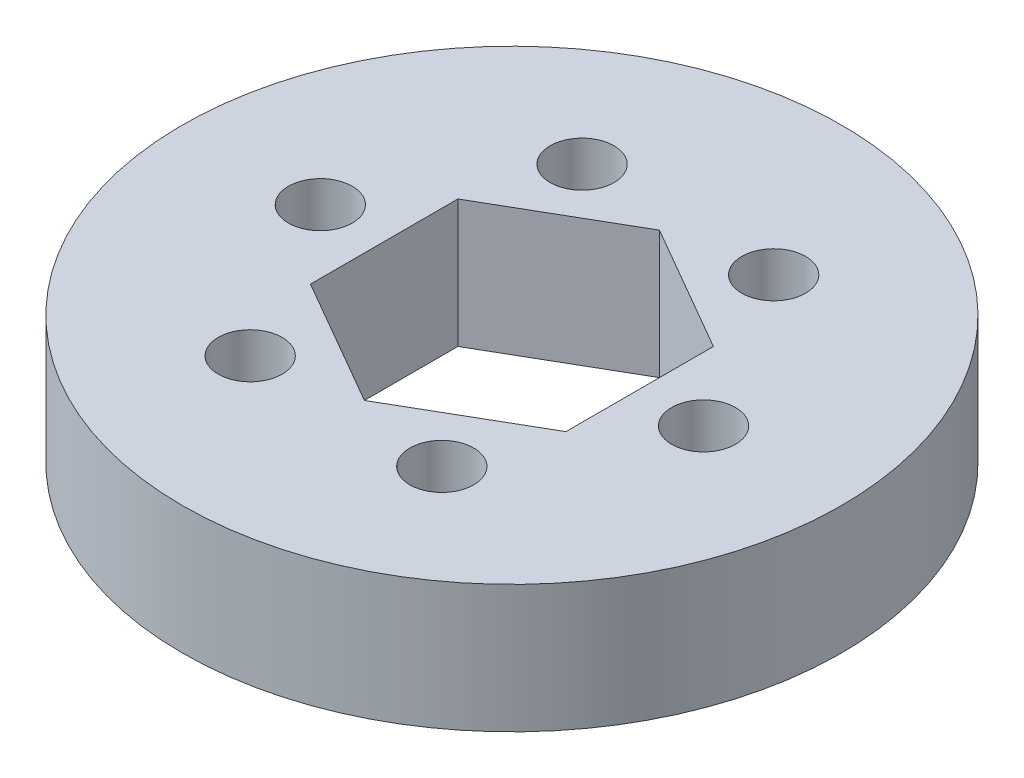
from build123d import *

# Parameters (mm, degrees)
SKETCH1_R           = 16.383
BOSS_EXTRUDE1_DEPTH = 6.35
CUT_EXTRUDE1_REACH  = 26.023
SKETCH3_R           = 1.5875


with BuildPart() as part:
    # Sketch1 → Boss-Extrude1 (new body)
    with BuildSketch(Plane(origin=(0, 0, 0), x_dir=(1, 0, 0), z_dir=(0, 1, 0))):
        Circle(SKETCH1_R)
        Polygon((0, 7.332348419), (-6.35, 3.666174209), (-6.35, -3.666174209), (0, -7.332348419), (6.35, -3.666174209), (6.35, 3.666174209), align=None, mode=Mode.SUBTRACT)
    extrude(amount=BOSS_EXTRUDE1_DEPTH)

    # Sketch3 → Cut-Extrude1 (cut, up to next)
    with BuildSketch(Plane(origin=(0, 6.35, 0), x_dir=(1, 0, 0), z_dir=(0, 1, 0)), mode=Mode.PRIVATE) as cut_extrude1_sk1:
        with Locations((9.525, 0)):
            Circle(SKETCH3_R)
    cut_extrude1_tool1 = extrude(cut_extrude1_sk1.sketch, amount=-CUT_EXTRUDE1_REACH, mode=Mode.PRIVATE) & part.part
    # Sketch3 → Cut-Extrude1 (cut, up to next)
    with BuildSketch(Plane(origin=(0, 6.35, 0), x_dir=(1, 0, 0), z_dir=(0, 1, 0)), mode=Mode.PRIVATE) as cut_extrude1_sk2:
        with Locations((4.7625, -8.248891971)):
            Circle(SKETCH3_R)
    cut_extrude1_tool2 = extrude(cut_extrude1_sk2.sketch, amount=-CUT_EXTRUDE1_REACH, mode=Mode.PRIVATE) & part.part
    # Sketch3 → Cut-Extrude1 (cut, up to next)
    with BuildSketch(Plane(origin=(0, 6.35, 0), x_dir=(1, 0, 0), z_dir=(0, 1, 0)), mode=Mode.PRIVATE) as cut_extrude1_sk3:
        with Locations((-4.7625, -8.248891971)):
            Circle(SKETCH3_R)
    cut_extrude1_tool3 = extrude(cut_extrude1_sk3.sketch, amount=-CUT_EXTRUDE1_REACH, mode=Mode.PRIVATE) & part.part
    # Sketch3 → Cut-Extrude1 (cut, up to next)
    with BuildSketch(Plane(origin=(0, 6.35, 0), x_dir=(1, 0, 0), z_dir=(0, 1, 0)), mode=Mode.PRIVATE) as cut_extrude1_sk4:
        with Locations((-9.525, 0)):
            Circle(SKETCH3_R)
    cut_extrude1_tool4 = extrude(cut_extrude1_sk4.sketch, amount=-CUT_EXTRUDE1_REACH, mode=Mode.PRIVATE) & part.part
    # Sketch3 → Cut-Extrude1 (cut, up to next)
    with BuildSketch(Plane(origin=(0, 6.35, 0), x_dir=(1, 0, 0), z_dir=(0, 1, 0)), mode=Mode.PRIVATE) as cut_extrude1_sk5:
        with Locations((-4.7625, 8.248891971)):
            Circle(SKETCH3_R)
    cut_extrude1_tool5 = extrude(cut_extrude1_sk5.sketch, amount=-CUT_EXTRUDE1_REACH, mode=Mode.PRIVATE) & part.part
    # Sketch3 → Cut-Extrude1 (cut, up to next)
    with BuildSketch(Plane(origin=(0, 6.35, 0), x_dir=(1, 0, 0), z_dir=(0, 1, 0)), mode=Mode.PRIVATE) as cut_extrude1_sk6:
        with Locations((4.7625, 8.248891971)):
            Circle(SKETCH3_R)
    cut_extrude1_tool6 = extrude(cut_extrude1_sk6.sketch, amount=-CUT_EXTRUDE1_REACH, mode=Mode.PRIVATE) & part.part
    add(cut_extrude1_tool1.solids().sort_by_distance((9.525, 6.35, 0))[0], mode=Mode.SUBTRACT)
    add(cut_extrude1_tool2.solids().sort_by_distance((4.7625, 6.35, 8.248892))[0], mode=Mode.SUBTRACT)
    add(cut_extrude1_tool3.solids().sort_by_distance((-4.7625, 6.35, 8.248892))[0], mode=Mode.SUBTRACT)
    add(cut_extrude1_tool4.solids().sort_by_distance((-9.525, 6.35, 0))[0], mode=Mode.SUBTRACT)
    add(cut_extrude1_tool5.solids().sort_by_distance((-4.7625, 6.35, -8.248892))[0], mode=Mode.SUBTRACT)
    add(cut_extrude1_tool6.solids().sort_by_distance((4.7625, 6.35, -8.248892))[0], mode=Mode.SUBTRACT)


solid = part.part
